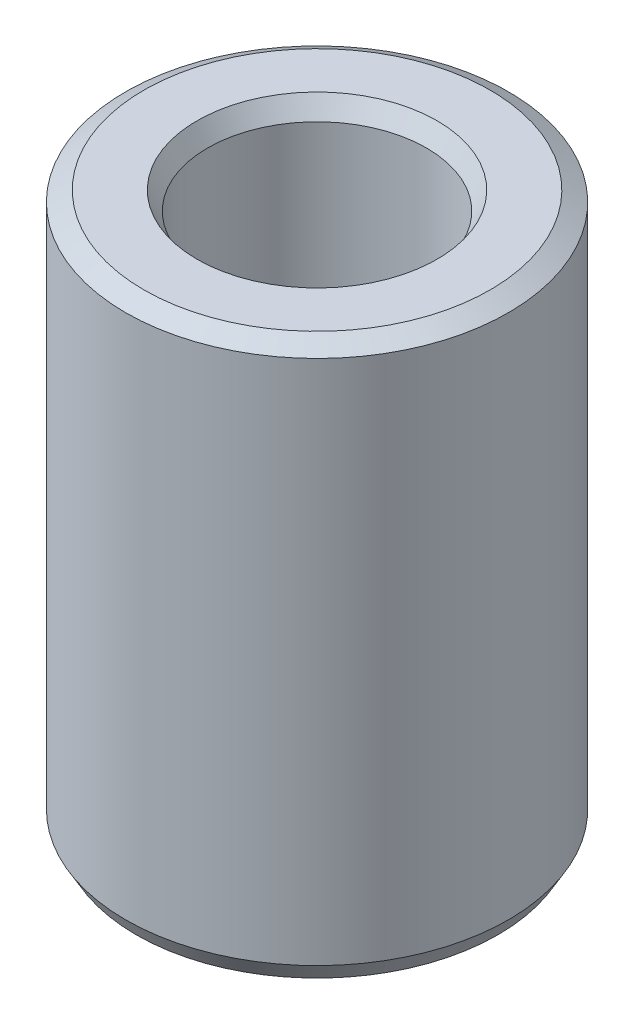
from build123d import *
from OCP.BRepFilletAPI import BRepFilletAPI_MakeChamfer

# Parameters (mm, degrees)
SKETCH1_R           = 25
BOSS_EXTRUDE1_DEPTH = 72.451078545
SKETCH2_R           = 14.29775189
CUT_EXTRUDE1_DEPTH  = 81.617360304
CHAMFER1_SIZE       = 1.380284888
CHAMFER1_SIZE2      = 2.390723555


with BuildPart() as part:
    # Sketch1 → Boss-Extrude1 (new body)
    with BuildSketch(Plane(origin=(0, 0, 0), x_dir=(1, 0, 0), z_dir=(0, 1, 0))):
        Circle(SKETCH1_R)
    extrude(amount=BOSS_EXTRUDE1_DEPTH)

    # Sketch2 → Cut-Extrude1 (cut, through all)
    with BuildSketch(Plane(origin=(0, 0, 0), x_dir=(1, 0, 0), z_dir=(0, 1, 0))):
        Circle(SKETCH2_R)
    extrude(amount=CUT_EXTRUDE1_DEPTH, mode=Mode.SUBTRACT)

    # Chamfer1: one chamfer whose edges measure the first distance from different faces: ONE call of the kernel's chamfer builder (chamfer() names one face for all edges)
    chamfer1_edges_1 = [part.edges().sort_by_distance(p)[0] for p in [
        (-14.29775189, 72.451078545, 0),
    ]]
    chamfer1_side_1 = [part.faces().sort_by_distance(p)[0] for p in [
        (-24.292893219, 72.451078545, 0),
    ]]
    chamfer1_edges_2 = [part.edges().sort_by_distance(p)[0] for p in [
        (-14.29775189, 0, 0),
    ]]
    chamfer1_side_2 = [part.faces().sort_by_distance(p)[0] for p in [
        (-14.29775189, 36.225539273, 0),
    ]]
    chamfer1_edges_3 = [part.edges().sort_by_distance(p)[0] for p in [
        (-25, 0, 0),
    ]]
    chamfer1_side_3 = [part.faces().sort_by_distance(p)[0] for p in [
        (-24.292893219, 0, 0),
    ]]
    chamfer1_edges_4 = [part.edges().sort_by_distance(p)[0] for p in [
        (-25, 72.451078545, 0),
    ]]
    chamfer1_side_4 = [part.faces().sort_by_distance(p)[0] for p in [
        (-25, 36.225539273, 0),
    ]]
    chamfer1 = BRepFilletAPI_MakeChamfer(part.part.solid().wrapped)
    for e in chamfer1_edges_1:
        chamfer1.Add(CHAMFER1_SIZE, CHAMFER1_SIZE2, e.wrapped, chamfer1_side_1[0].wrapped)  # the first distance lies on this face
    for e in chamfer1_edges_2:
        chamfer1.Add(CHAMFER1_SIZE, CHAMFER1_SIZE2, e.wrapped, chamfer1_side_2[0].wrapped)  # the first distance lies on this face
    for e in chamfer1_edges_3:
        chamfer1.Add(CHAMFER1_SIZE, CHAMFER1_SIZE2, e.wrapped, chamfer1_side_3[0].wrapped)  # the first distance lies on this face
    for e in chamfer1_edges_4:
        chamfer1.Add(CHAMFER1_SIZE, CHAMFER1_SIZE2, e.wrapped, chamfer1_side_4[0].wrapped)  # the first distance lies on this face
    add(Compound.cast(chamfer1.Shape()), mode=Mode.REPLACE)


solid = part.part
